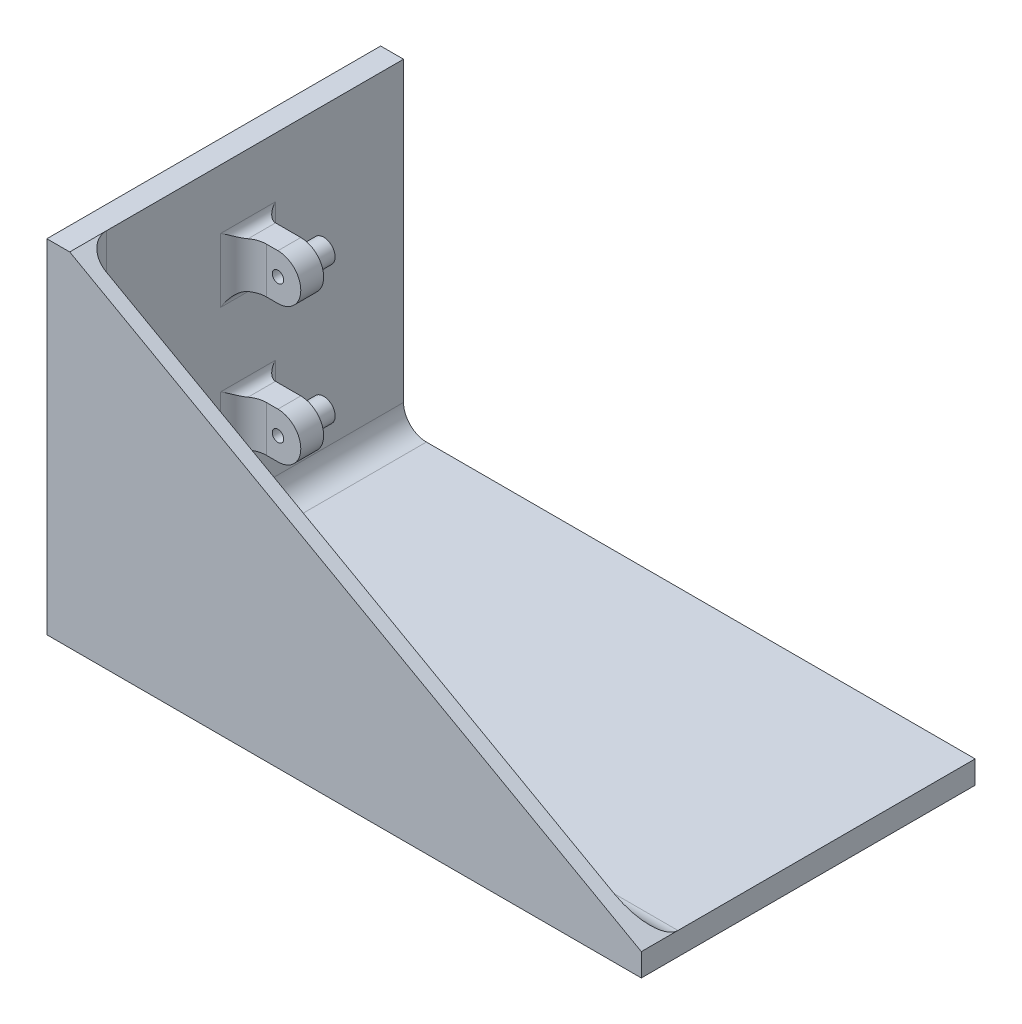
from build123d import *

# Parameters (mm, degrees)
SCHIZZO1_W                   = 5
SCHIZZO1_H                   = 70
ESTRUSIONE_ESTRUSIONE1_DEPTH = 70
ESTRUSIONE_ESTRUSIONE2_START = -35
ESTRUSIONE_ESTRUSIONE2_DEPTH = 5
SCHIZZO3_R                   = 2.5
ESTRUSIONE_ESTRUSIONE3_DEPTH = 5
SCHIZZO4_W                   = 130
SCHIZZO4_H                   = 70
ESTRUSIONE_ESTRUSIONE4_DEPTH = 5
SCHIZZO5_R                   = 1.25
TAGLIO_ESTRUSIONE1_DEPTH     = 151.166574177
ESTRUSIONE_ESTRUSIONE5_DEPTH = 3
RACCORDO1_R                  = 5
RACCORDO2_R                  = 5
RACCORDO3_R                  = 2
RACCORDO4_R                  = 2


with BuildPart() as part:
    # Schizzo1 → Estrusione-Estrusione1 (new body)
    with BuildSketch(Plane.XY):
        with Locations((-2.5, 35)):
            Rectangle(SCHIZZO1_W, SCHIZZO1_H)
    extrude(amount=ESTRUSIONE_ESTRUSIONE1_DEPTH)

    # Schizzo2 → Estrusione-Estrusione2 (add)
    with BuildSketch(Plane.XY.offset(70).offset(ESTRUSIONE_ESTRUSIONE2_START)):
        with BuildLine():
            Line((0, 55), (0, 45))
            Line((0, 45), (7.531619243, 45))
            ThreePointArc((7.531619243, 45), (12.531619243, 50), (7.531619243, 55))
            Line((7.531619243, 55), (0, 55))
        make_face()
        with BuildLine():
            Line((0, 25), (0, 15))
            Line((0, 15), (7.531619243, 15))
            ThreePointArc((7.531619243, 15), (12.531619243, 20), (7.531619243, 25))
            Line((7.531619243, 25), (0, 25))
        make_face()
    extrude(amount=-ESTRUSIONE_ESTRUSIONE2_DEPTH)

    # Schizzo3 → Estrusione-Estrusione3 (add)
    with BuildSketch(Plane(origin=(0, 0, 30), x_dir=(-1, 0, 0), z_dir=(0, 0, -1))):
        with Locations((-7.547600082, 50.061310314)):
            Circle(SCHIZZO3_R)
        with Locations((-7.547600082, 19.939772921)):
            Circle(SCHIZZO3_R)
    extrude(amount=ESTRUSIONE_ESTRUSIONE3_DEPTH)

    # Schizzo4 → Estrusione-Estrusione4 (add)
    with BuildSketch(Plane.XZ):
        with Locations((60, 35)):
            Rectangle(SCHIZZO4_W, SCHIZZO4_H)
    extrude(amount=ESTRUSIONE_ESTRUSIONE4_DEPTH)

    # Schizzo5 → Taglio-Estrusione1 (cut, through all)
    with BuildSketch(Plane(origin=(0, 0, 25), x_dir=(-1, 0, 0), z_dir=(0, 0, -1))):
        with Locations((-7.547600082, 50.061310314)):
            Circle(SCHIZZO5_R)
        with Locations((-7.547600082, 19.939772921)):
            Circle(SCHIZZO5_R)
    extrude(amount=-TAGLIO_ESTRUSIONE1_DEPTH, mode=Mode.SUBTRACT)

    # Schizzo6 → Estrusione-Estrusione5 (add)
    with BuildSketch(Plane.XY.offset(70)):
        Polygon((125, 0), (0, 70), (-5, 70), (-5, -5), (125, -5), align=None)
    extrude(amount=ESTRUSIONE_ESTRUSIONE5_DEPTH)

    # Raccordo1
    raccordo1_edges = [part.edges().sort_by_distance(p)[0] for p in [
        (0, 0, 35),
        (0, 35, 70),
        (62.5, 0, 70),
    ]]
    fillet(raccordo1_edges, radius=RACCORDO1_R)

    # Raccordo2
    raccordo2_edges = [part.edges().sort_by_distance(p)[0] for p in [
        (0, 20, 35),
        (0, 50, 35),
    ]]
    fillet(raccordo2_edges, radius=RACCORDO2_R)

    # Raccordo3
    raccordo3_edges = [part.edges().sort_by_distance(p)[0] for p in [
        (0, 20, 30),
        (0, 50, 30),
    ]]
    fillet(raccordo3_edges, radius=RACCORDO3_R)

    # Raccordo4
    raccordo4_edges = [part.edges().sort_by_distance(p)[0] for p in [
        (0, 25, 34),
        (0, 15, 34),
        (0, 45, 34),
        (0, 55, 34),
    ]]
    fillet(raccordo4_edges, radius=RACCORDO4_R)


solid = part.part
